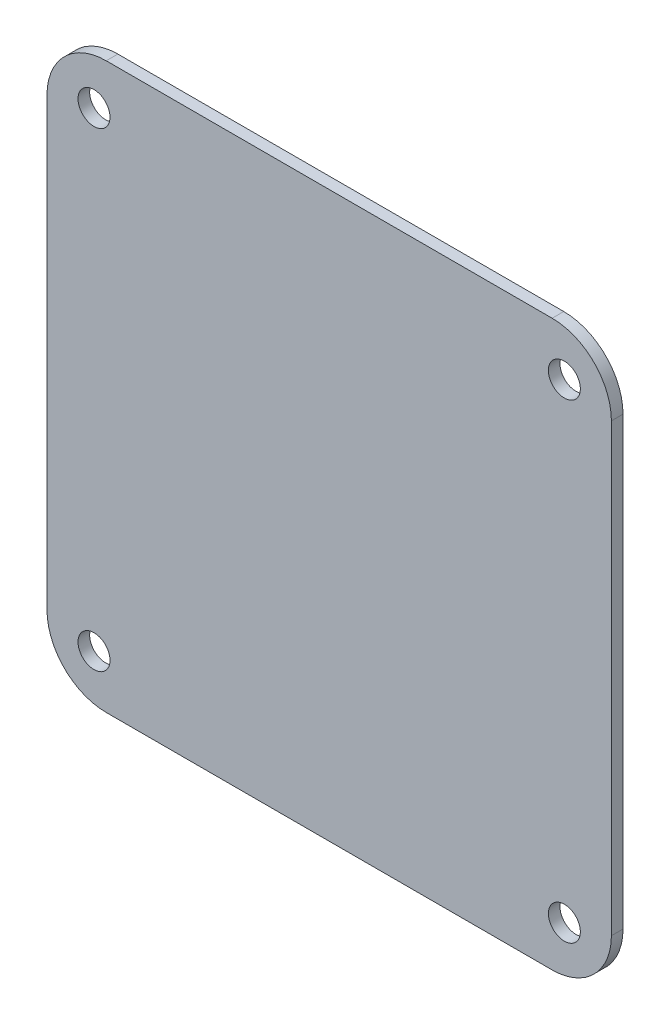
from build123d import *

# Parameters (mm, degrees)
SKETCH1_W               = 76.2
SKETCH1_H               = 76.2
BOSS_EXTRUDE1_DEPTH     = 1.57
CUT_EXTRUDE1_DEPTH      = 16
CUT_EXTRUDE1_DEPTH_BACK = 10.57
SKETCH1_4_R             = 2.159
CUT_EXTRUDE2_DEPTH      = 24
CUT_EXTRUDE2_DEPTH_BACK = 19.57
SKETCH1_5_R             = 2.159
FILLET1_R               = 8


with BuildPart() as part:
    # Sketch1 → Boss-Extrude1 (new body)
    with BuildSketch(Plane.XY):
        Rectangle(SKETCH1_W, SKETCH1_H)
    extrude(amount=BOSS_EXTRUDE1_DEPTH)

    # Sketch1<4> → Cut-Extrude1 (cut, two sides: drawn at the far end of the back side and taken through both)
    with BuildSketch(Plane.XY.offset(-CUT_EXTRUDE1_DEPTH_BACK)):
        with Locations((31.75, 31.75)):
            Circle(SKETCH1_4_R)
    extrude(amount=CUT_EXTRUDE1_DEPTH + CUT_EXTRUDE1_DEPTH_BACK, mode=Mode.SUBTRACT)

    # Sketch1<5> → Cut-Extrude2 (cut, two sides: drawn at the far end of the back side and taken through both)
    with BuildSketch(Plane.XY.offset(-CUT_EXTRUDE2_DEPTH_BACK)):
        with Locations((-31.75, 31.75)):
            Circle(SKETCH1_5_R)
        with Locations((-31.75, -31.75)):
            Circle(SKETCH1_5_R)
        with Locations((31.75, -31.75)):
            Circle(SKETCH1_5_R)
    extrude(amount=CUT_EXTRUDE2_DEPTH + CUT_EXTRUDE2_DEPTH_BACK, mode=Mode.SUBTRACT)

    # Fillet1
    fillet1_edges = [part.edges().sort_by_distance(p)[0] for p in [
        (-38.1, -38.1, 0.785),
        (38.1, -38.1, 0.785),
        (38.1, 38.1, 0.785),
        (-38.1, 38.1, 0.785),
    ]]
    fillet(fillet1_edges, radius=FILLET1_R)


solid = part.part
